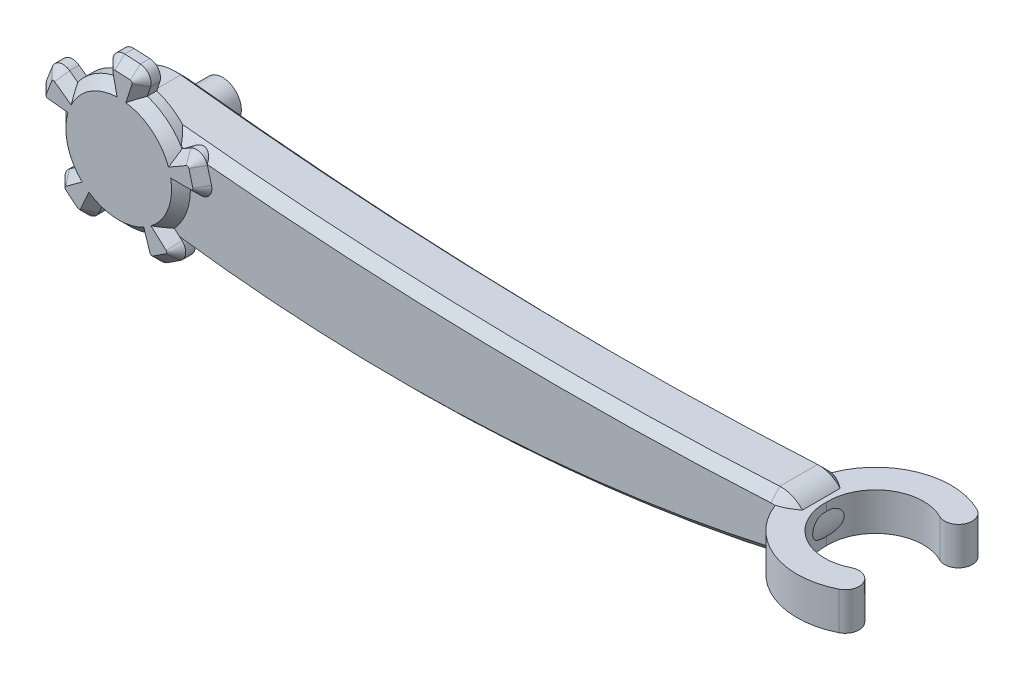
from build123d import *

# Parameters (mm, degrees)
BOSS_EXTRUDE2_DEPTH = 7.5
CHAMFER1_SIZE       = 2.5
SKETCH4_R           = 16.5
BOSS_EXTRUDE3_DEPTH = 2.5
BOSS_EXTRUDE4_DEPTH = 5
CHAMFER2_SIZE       = 2.5
SKETCH7_R           = 5
BOSS_EXTRUDE5_DEPTH = 10
BOSS_EXTRUDE6_DEPTH = 5


with BuildPart() as part:
    # Sketch1 → Boss-Extrude2 (new, symmetric)
    with BuildSketch(Plane.XY):
        with BuildLine():
            ThreePointArc((84.870261249, 7.488799052), (0.40775788, 6.440358665), (-83.841906631, 12.523756762))
            ThreePointArc((-83.841906631, 12.523756762), (-97.762767621, 1.758751671), (-87.358253429, -12.43356279))
            ThreePointArc((-87.358253429, -12.43356279), (0.045661199, -18.396895022), (86.948659394, -7.312016663))
            ThreePointArc((86.948659394, -7.312016663), (92.707133032, 1.042951444), (84.870261249, 7.488799052))
        make_face()
    extrude(amount=BOSS_EXTRUDE2_DEPTH, both=True)

    # Chamfer1
    chamfer1_edges = [part.edges().sort_by_distance(p)[0] for p in [
        (92.707133032, 1.042951444, 7.5),
        (0.40775788, 6.440358665, 7.5),
        (-97.762767621, 1.758751671, 7.5),
        (0.045661199, -18.396895022, 7.5),
        (-97.762767621, 1.758751671, -7.5),
        (0.40775788, 6.440358665, -7.5),
        (92.707133032, 1.042951444, -7.5),
        (0.045661199, -18.396895022, -7.5),
    ]]
    chamfer(chamfer1_edges, length=CHAMFER1_SIZE)

    # Sketch4 → Boss-Extrude3 (add, symmetric)
    with BuildSketch(Plane.XY.offset(7.5)):
        with Locations(Location((-85.280003554, 0, 0), (0, 0, 301.384766356))):
            Circle(SKETCH4_R)
    extrude(amount=BOSS_EXTRUDE3_DEPTH, both=True)

    # Sketch5 → Boss-Extrude4 (add)
    with BuildSketch(Plane.XY.offset(10)):
        with BuildLine():
            Line((-68.665882393, 9.592167325), (-85.280003554, 0))
            Line((-85.280003554, 0), (-66.095668905, 0))
            ThreePointArc((-66.095668905, 0), (-63.715608884, 1.173715713), (-63.197891426, 3.776457135))
            Line((-63.197891426, 3.776457135), (-64.268104914, 7.770548248))
            ThreePointArc((-64.268104914, 7.770548248), (-66.017832096, 9.765729711), (-68.665882393, 9.592167325))
        make_face()
        with BuildLine():
            Line((-71.023264529, -12.836825476), (-85.280003554, 0))
            Line((-85.280003554, 0), (-79.351718121, -18.245386479))
            ThreePointArc((-79.351718121, -18.245386479), (-77.49996915, -20.146259969), (-74.864631467, -19.834347199))
            Line((-74.864631467, -19.834347199), (-71.396739243, -17.582271657))
            ThreePointArc((-71.396739243, -17.582271657), (-70.039904347, -15.30163724), (-71.023264529, -12.836825476))
        make_face()
        with BuildLine():
            Line((-93.082975429, -17.525761777), (-85.280003554, 0))
            Line((-85.280003554, 0), (-100.800456311, -11.276268982))
            ThreePointArc((-100.800456311, -11.276268982), (-102.036072529, -13.62478912), (-100.925061727, -16.034757849))
            Line((-100.925061727, -16.034757849), (-97.711572975, -18.636989732))
            ThreePointArc((-97.711572975, -18.636989732), (-95.12327571, -19.222661609), (-93.082975429, -17.525761777))
        make_face()
        with BuildLine():
            Line((-104.35924441, 2.00530902), (-85.280003554, 0))
            Line((-85.280003554, 0), (-100.800456311, 11.276268982))
            ThreePointArc((-100.800456311, 11.276268982), (-103.415858102, 11.725677203), (-105.364553347, 9.924321847))
            Line((-105.364553347, 9.924321847), (-106.8464003, 6.063978554))
            ThreePointArc((-106.8464003, 6.063978554), (-106.603579514, 3.421379012), (-104.35924441, 2.00530902))
        make_face()
        with BuildLine():
            Line((-89.268651008, 18.765110909), (-85.280003554, 0))
            Line((-85.280003554, 0), (-79.351718121, 18.245386479))
            ThreePointArc((-79.351718121, 18.245386479), (-79.732509104, 20.871656173), (-82.047879802, 22.168326066))
            Line((-82.047879802, 22.168326066), (-86.177200337, 22.384734585))
            ThreePointArc((-86.177200337, 22.384734585), (-88.615426102, 21.337190126), (-89.268651008, 18.765110909))
        make_face()
    extrude(amount=-BOSS_EXTRUDE4_DEPTH)

    # Chamfer2
    chamfer2_edges = [part.edges().sort_by_distance(p)[0] for p in [
        (-69.828233392, 8.921083662, 10),
        (-66.017832096, 9.765729711, 10),
        (-63.73299817, 5.773502692, 10),
        (-63.715608884, 1.173715713, 10),
        (-67.437836229, 0, 10),
        (-69.875926517, -5.913071167, 10),
        (-72.020689231, -11.938740241, 10),
        (-70.039904347, -15.30163724, 10),
        (-73.130685355, -18.708309428, 10),
        (-77.49996915, -20.146259969, 10),
        (-79.766470634, -16.968909499, 10),
        (-86.143546832, -16.477387323, 10),
        (-92.537066797, -16.299630914, 10),
        (-95.12327571, -19.222661609, 10),
        (-99.318317351, -17.33587379, 10),
        (-102.036072529, -13.62478912, 10),
        (-99.714620136, -10.487362822, 10),
        (-101.217779688, -4.270514244, 10),
        (-103.024429619, 1.865014332, 10),
        (-106.603579514, 3.421379012, 10),
        (-106.105476824, 7.994150201, 10),
        (-103.415858102, 11.725677203, 10),
        (-99.714620136, 10.487362822, 10),
        (-94.266547632, 13.838064371, 10),
        (-88.98959873, 17.45227316, 10),
        (-88.615426102, 21.337190126, 10),
        (-84.112540069, 22.276530326, 10),
        (-79.732509104, 20.871656173, 10),
        (-79.766470634, 16.968909499, 10),
        (-74.896217101, 12.822908364, 10),
    ]]
    chamfer(chamfer2_edges, length=CHAMFER2_SIZE - 0.0001)  # a hair under: the kernel refuses the full size

    # Sketch7 → Boss-Extrude5 (add)
    with BuildSketch(Plane(origin=(0, 0, -7.5), x_dir=(-1, 0, 0), z_dir=(0, 0, -1))):
        with Locations((85.280003554, 0)):
            Circle(SKETCH7_R)
    extrude(amount=BOSS_EXTRUDE5_DEPTH)

    # Sketch9 → Boss-Extrude6 (add, symmetric)
    with BuildSketch(Plane(origin=(0, 0, 0), x_dir=(1, 0, 0), z_dir=(0, 1, 0))):
        with BuildLine():
            ThreePointArc((84.870261249, 0), (94.200330652, 17.334779304), (113.863897262, 18.277603124))
            ThreePointArc((113.863897262, 18.277603124), (115.490374175, 13.34887379), (110.561644841, 11.722396876))
            ThreePointArc((110.561644841, 11.722396876), (98.050130281, 11.084670869), (92.212771052, 0))
            ThreePointArc((92.212771052, 0), (98.050130281, -11.084670869), (110.561644841, -11.722396876))
            ThreePointArc((110.561644841, -11.722396876), (115.490374175, -13.34887379), (113.863897262, -18.277603124))
            ThreePointArc((113.863897262, -18.277603124), (94.200330652, -17.334779304), (84.870261249, 0))
        make_face()
    extrude(amount=BOSS_EXTRUDE6_DEPTH, both=True)


solid = part.part
